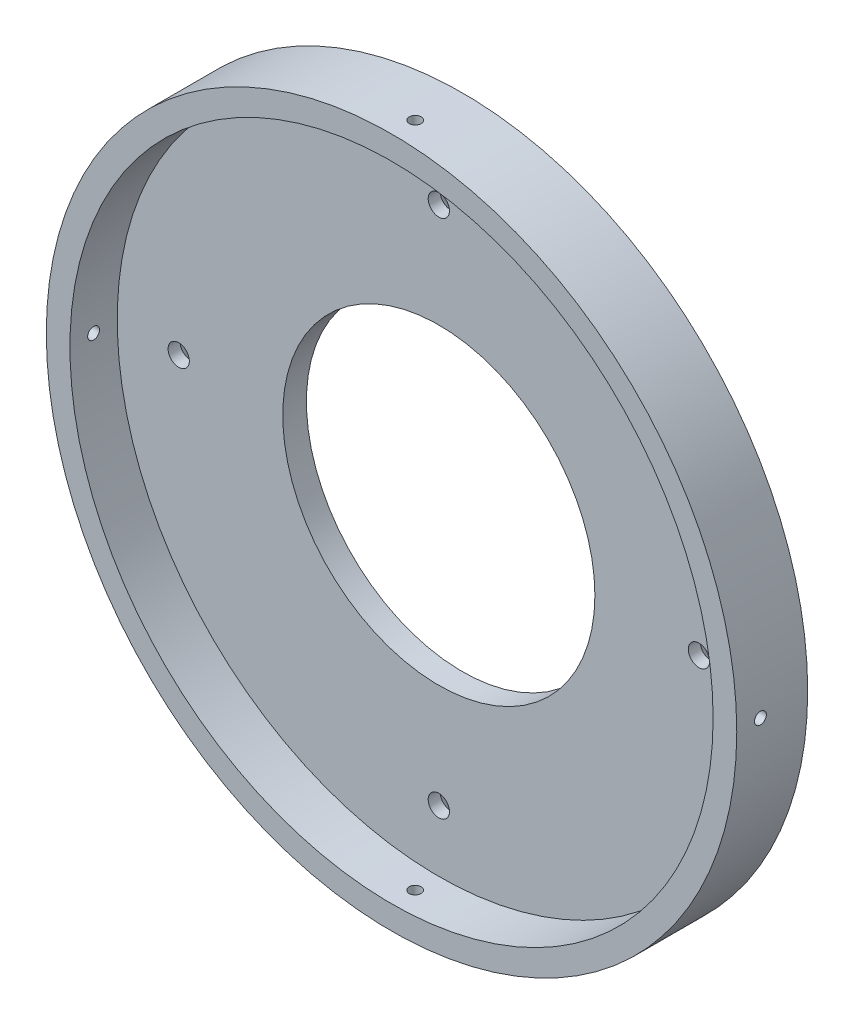
from build123d import *

# Parameters (mm, degrees)
SKETCH1_R                                           = 73
SKETCH1_R_2                                         = 33
BOSS_EXTRUDE1_DEPTH                                 = 5
SKETCH2_R                                           = 73
SKETCH2_R_2                                         = 68
BOSS_EXTRUDE2_DEPTH                                 = 10
CUT_EXTRUDE1_REACH                                  = 106.322
CUT_EXTRUDE1_END_RADIUS                             = 73
SKETCH3_R                                           = 1.25
CIRPATTERN1_COUNT                                   = 4
CSK_FOR_M4_COUNTERSUNK_FLAT_HEAD_SCREW3_D           = 4.5
CSK_FOR_M4_COUNTERSUNK_FLAT_HEAD_SCREW3_CSINK_D     = 9.4
CSK_FOR_M4_COUNTERSUNK_FLAT_HEAD_SCREW3_CSINK_ANGLE = 90


with BuildPart() as part:
    # Sketch1 → Boss-Extrude1 (new body)
    with BuildSketch(Plane.XY):
        Circle(SKETCH1_R)
        Circle(SKETCH1_R_2, mode=Mode.SUBTRACT)
    extrude(amount=BOSS_EXTRUDE1_DEPTH)

    # Sketch2 → Boss-Extrude2 (add)
    with BuildSketch(Plane.XY.offset(5)):
        Circle(SKETCH2_R)
        Circle(SKETCH2_R_2, mode=Mode.SUBTRACT)
    extrude(amount=BOSS_EXTRUDE2_DEPTH)

    # Cut-Extrude1: up to this cylinder (the profile starts inside it)
    cut_extrude1_end = Plane(origin=(0, 0, 10), z_dir=(0, 0, -1)) * Cylinder(CUT_EXTRUDE1_END_RADIUS, 359.644, mode=Mode.PRIVATE)
    # Sketch3 → Cut-Extrude1 (cut, up to the surface)
    with BuildSketch(Plane(origin=(0, 0, 0), x_dir=(1, 0, 0), z_dir=(0, 1, 0)), mode=Mode.PRIVATE) as cut_extrude1_sk1:
        with Locations((0, -10)):
            Circle(SKETCH3_R)
    cut_extrude1_tool1 = extrude(cut_extrude1_sk1.sketch, amount=-CUT_EXTRUDE1_REACH, mode=Mode.PRIVATE) & cut_extrude1_end
    cut_extrude1 = cut_extrude1_tool1.solids().sort_by_distance((0, 0, 10))[0]
    add(cut_extrude1, mode=Mode.SUBTRACT)

    # CirPattern1: Cut-Extrude1 ×4 about axis
    cirpattern1_axis = Axis((0, 0, 5), (0, 0, -1))
    for i in range(1, CIRPATTERN1_COUNT):
        add(cut_extrude1.rotate(cirpattern1_axis, i * 360 / CIRPATTERN1_COUNT), mode=Mode.SUBTRACT)

    # CSK for M4 Countersunk Flat Head Screw3 (through all)
    with Locations(Plane(origin=(0, 0, 0), x_dir=(-1, 0, 0), z_dir=(0, 0, -1))):
        with Locations((0, 55), (55, 0), (0, -55), (-55, 0)):
            CounterSinkHole(CSK_FOR_M4_COUNTERSUNK_FLAT_HEAD_SCREW3_D / 2, CSK_FOR_M4_COUNTERSUNK_FLAT_HEAD_SCREW3_CSINK_D / 2, counter_sink_angle=CSK_FOR_M4_COUNTERSUNK_FLAT_HEAD_SCREW3_CSINK_ANGLE)


solid = part.part
